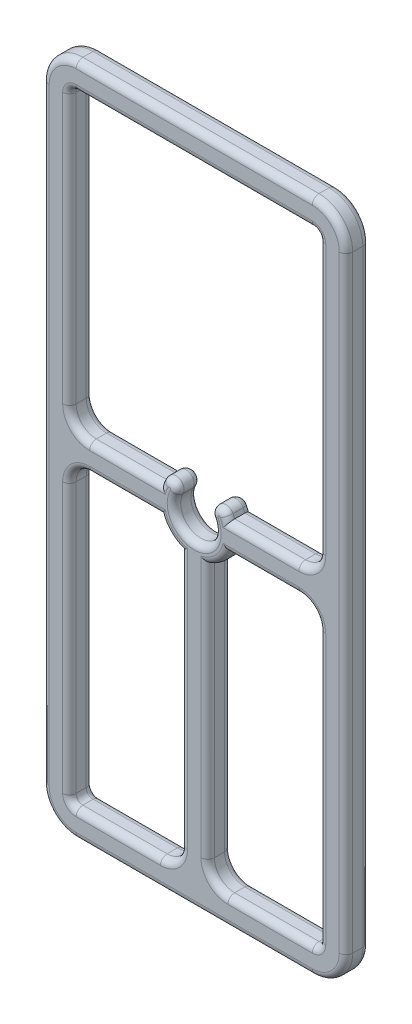
from build123d import *

# Parameters (mm, degrees)
SKETCH1_W           = 45
SKETCH1_H           = 100
BOSS_EXTRUDE2_DEPTH = 3.5
FILLET2_R           = 5
FILLET3_R           = 1
FILLET4_R           = 3
FILLET5_R           = 1


with BuildPart() as part:
    # Sketch1 → Boss-Extrude2 (new body)
    with BuildSketch(Plane.XY):
        Rectangle(SKETCH1_W, SKETCH1_H)
        with BuildLine():
            Line((-18.5, -46), (-18.5, -2))
            Line((-18.5, -2), (-5.015974482, -2))
            ThreePointArc((-5.015974482, -2), (-3.818376618, -3.818376618), (-2, -5.015974482))
            Line((-2, -5.015974482), (-2, -46))
            Line((-2, -46), (-18.5, -46))
        make_face(mode=Mode.SUBTRACT)
        with BuildLine():
            Line((18.5, 46), (-18.5, 46))
            Line((-18.5, 46), (-18.5, 2))
            Line((-18.5, 2), (-5.015974482, 2))
            ThreePointArc((-5.015974482, 2), (-4.894440416, 2.281327029), (-4.757142857, 2.555306603))
            ThreePointArc((-4.757142857, 2.555306603), (-3.132154088, 3.044603549), (-2.642857143, 1.41961478))
            ThreePointArc((-2.642857143, 1.41961478), (0, -3), (2.642857143, 1.41961478))
            ThreePointArc((2.642857143, 1.41961478), (3.132154088, 3.044603549), (4.757142857, 2.555306603))
            ThreePointArc((4.757142857, 2.555306603), (4.894440416, 2.281327029), (5.015974482, 2))
            Line((5.015974482, 2), (18.5, 2))
            Line((18.5, 2), (18.5, 46))
        make_face(mode=Mode.SUBTRACT)
        with BuildLine():
            Line((18.5, -46), (18.5, -2))
            Line((18.5, -2), (5.015974482, -2))
            ThreePointArc((5.015974482, -2), (3.818376618, -3.818376618), (2, -5.015974482))
            Line((2, -5.015974482), (2, -46))
            Line((2, -46), (18.5, -46))
        make_face(mode=Mode.SUBTRACT)
    extrude(amount=BOSS_EXTRUDE2_DEPTH)

    # Fillet2
    fillet2_edges = [part.edges().sort_by_distance(p)[0] for p in [
        (-22.5, 50, 1.75),
        (22.5, 50, 1.75),
        (22.5, -50, 1.75),
        (-22.5, -50, 1.75),
    ]]
    fillet(fillet2_edges, radius=FILLET2_R)

    # Fillet3
    fillet3_edges = [part.edges().sort_by_distance(p)[0] for p in [
        (18.5, 46, 1.75),
        (-18.5, 46, 1.75),
        (-18.5, -46, 1.75),
        (18.5, -46, 1.75),
    ]]
    fillet(fillet3_edges, radius=FILLET3_R)

    # Fillet4
    fillet4_edges = [part.edges().sort_by_distance(p)[0] for p in [
        (18.5, 2, 1.75),
        (-18.5, 2, 1.75),
        (-2, -46, 1.75),
        (-18.5, -2, 1.75),
        (2, -46, 1.75),
        (18.5, -2, 1.75),
    ]]
    fillet(fillet4_edges, radius=FILLET4_R)

    # Fillet5
    # the kernel refuses this fillet: 1 mm, written as the material it takes off along each edge
    with BuildSketch(Plane(origin=(17.5, 46, 0), x_dir=(0, 1, 0), z_dir=(-1, 0, 0)), Plane(origin=(17.5, 46, 3.5), x_dir=(0, 0, -1), z_dir=(-1, 0, 0)), Plane(origin=(17.5, -50, 0), x_dir=(0, 1, 0), z_dir=(-1, 0, 0)), Plane(origin=(17.5, -50, 3.5), x_dir=(0, 0, -1), z_dir=(-1, 0, 0)), Plane(origin=(-17.5, 50, 0), x_dir=(0, -1, 0), z_dir=(1, 0, 0)), Plane(origin=(-17.5, 50, 3.5), x_dir=(0, 0, -1), z_dir=(1, 0, 0))) as fillet5_piece_1:
        with BuildLine():
            CenterArc((FILLET5_R, -FILLET5_R), FILLET5_R, 90, 90)
            Line((0, -FILLET5_R), (0, 0))
            Line((0, 0), (FILLET5_R, 0))
        make_face()
    fillet5_piece_1_solid = extrude(amount=35, mode=Mode.PRIVATE)
    with BuildSketch(Plane(origin=(18.5, -45, 0), x_dir=(1, 0, 0), z_dir=(0, 1, 0)), Plane(origin=(18.5, -45, 3.5), x_dir=(0, 0, -1), z_dir=(0, 1, 0)), Plane(origin=(-18.5, 45, 0), x_dir=(-1, 0, 0), z_dir=(0, -1, 0)), Plane(origin=(-18.5, 45, 3.5), x_dir=(0, 0, -1), z_dir=(0, -1, 0)), Plane(origin=(18.5, 5, 3.5), x_dir=(0, 0, -1), z_dir=(0, 1, 0)), Plane(origin=(18.5, 5, 0), x_dir=(1, 0, 0), z_dir=(0, 1, 0))) as fillet5_piece_2:
        with BuildLine():
            CenterArc((FILLET5_R, -FILLET5_R), FILLET5_R, 90, 90)
            Line((0, -FILLET5_R), (0, 0))
            Line((0, 0), (FILLET5_R, 0))
        make_face()
    fillet5_piece_2_solid = extrude(amount=40, mode=Mode.PRIVATE)
    with BuildSketch(Plane(origin=(-5, -46, 0), x_dir=(0, -1, 0), z_dir=(-1, 0, 0)), Plane(origin=(-5, -46, 3.5), x_dir=(0, 0, -1), z_dir=(-1, 0, 0))) as fillet5_piece_3:
        with BuildLine():
            CenterArc((FILLET5_R, FILLET5_R), FILLET5_R, 180, 90)
            Line((0, FILLET5_R), (0, 0))
            Line((0, 0), (FILLET5_R, 0))
        make_face()
    fillet5_piece_3_solid = extrude(amount=12.5, mode=Mode.PRIVATE)
    with BuildSketch(Plane(origin=(17.5, 45, 0), x_dir=(0, 1, 0), z_dir=(-1, 0, 0))) as fillet5_piece_4:
        with BuildLine():
            CenterArc((1 + FILLET5_R, -FILLET5_R), FILLET5_R, 90, 90)
            Line((1, -FILLET5_R), (1, 0))
            Line((1, 0), (1 + FILLET5_R, 0))
        make_face()
    fillet5_piece_4_solid = revolve(axis=Axis((17.5, 45, 0), (0, 0, -1)), revolution_arc=90, mode=Mode.PRIVATE)
    with BuildSketch(Plane(origin=(17.5, 45, 3.5), x_dir=(0, 1, 0), z_dir=(-1, 0, 0))) as fillet5_piece_5:
        with BuildLine():
            CenterArc((1 + FILLET5_R, FILLET5_R), FILLET5_R, 180, 90)
            Line((1 + FILLET5_R, 0), (1, 0))
            Line((1, 0), (1, FILLET5_R))
        make_face()
    fillet5_piece_5_solid = revolve(axis=Axis((17.5, 45, 3.5), (0, 0, -1)), revolution_arc=90, mode=Mode.PRIVATE)
    with BuildSketch(Plane(origin=(17.5, -45, 0), x_dir=(1, 0, 0), z_dir=(0, 1, 0))) as fillet5_piece_6:
        with BuildLine():
            CenterArc((1 + FILLET5_R, -FILLET5_R), FILLET5_R, 90, 90)
            Line((1, -FILLET5_R), (1, 0))
            Line((1, 0), (1 + FILLET5_R, 0))
        make_face()
    fillet5_piece_6_solid = revolve(axis=Axis((17.5, -45, 0), (0, 0, -1)), revolution_arc=90, mode=Mode.PRIVATE)
    with BuildSketch(Plane(origin=(17.5, -45, 3.5), x_dir=(1, 0, 0), z_dir=(0, 1, 0))) as fillet5_piece_7:
        with BuildLine():
            CenterArc((1 + FILLET5_R, FILLET5_R), FILLET5_R, 180, 90)
            Line((1 + FILLET5_R, 0), (1, 0))
            Line((1, 0), (1, FILLET5_R))
        make_face()
    fillet5_piece_7_solid = revolve(axis=Axis((17.5, -45, 3.5), (0, 0, -1)), revolution_arc=90, mode=Mode.PRIVATE)
    with BuildSketch(Plane(origin=(-17.5, -45, 0), x_dir=(-1, 0, 0), z_dir=(0, 1, 0))) as fillet5_piece_8:
        with BuildLine():
            CenterArc((1 + FILLET5_R, FILLET5_R), FILLET5_R, 180, 90)
            Line((1, FILLET5_R), (1, 0))
            Line((1, 0), (1 + FILLET5_R, 0))
        make_face()
    fillet5_piece_8_solid = revolve(axis=Axis((-17.5, -45, 0), (0, 0, 1)), revolution_arc=90, mode=Mode.PRIVATE)
    with BuildSketch(Plane(origin=(-17.5, -45, 3.5), x_dir=(-1, 0, 0), z_dir=(0, 1, 0))) as fillet5_piece_9:
        with BuildLine():
            CenterArc((1 + FILLET5_R, -FILLET5_R), FILLET5_R, 90, 90)
            Line((1 + FILLET5_R, 0), (1, 0))
            Line((1, 0), (1, -FILLET5_R))
        make_face()
    fillet5_piece_9_solid = revolve(axis=Axis((-17.5, -45, 3.5), (0, 0, 1)), revolution_arc=90, mode=Mode.PRIVATE)
    with BuildSketch(Plane(origin=(-17.5, 45, 0), x_dir=(0, 1, 0), z_dir=(1, 0, 0))) as fillet5_piece_10:
        with BuildLine():
            CenterArc((1 + FILLET5_R, FILLET5_R), FILLET5_R, 180, 90)
            Line((1, FILLET5_R), (1, 0))
            Line((1, 0), (1 + FILLET5_R, 0))
        make_face()
    fillet5_piece_10_solid = revolve(axis=Axis((-17.5, 45, 0), (0, 0, 1)), revolution_arc=90, mode=Mode.PRIVATE)
    with BuildSketch(Plane(origin=(-17.5, 45, 3.5), x_dir=(0, 1, 0), z_dir=(1, 0, 0))) as fillet5_piece_11:
        with BuildLine():
            CenterArc((1 + FILLET5_R, -FILLET5_R), FILLET5_R, 90, 90)
            Line((1 + FILLET5_R, 0), (1, 0))
            Line((1, 0), (1, -FILLET5_R))
        make_face()
    fillet5_piece_11_solid = revolve(axis=Axis((-17.5, 45, 3.5), (0, 0, 1)), revolution_arc=90, mode=Mode.PRIVATE)
    with BuildSketch(Plane(origin=(-15.5, 2, 0), x_dir=(0, -1, 0), z_dir=(1, 0, 0))) as fillet5_piece_12_section:
        with BuildLine():
            CenterArc((FILLET5_R, -FILLET5_R), FILLET5_R, 90, 90)
            Line((0, -FILLET5_R), (0, 0))
            Line((0, 0), (FILLET5_R, 0))
        make_face()
    fillet5_piece_12 = extrude(amount=12.984025518, mode=Mode.PRIVATE)
    fillet5_piece_12 = fillet5_piece_12 - Plane(origin=(0, 0, 0.227276512), x_dir=(-0.9288841632581055, 0.3703703703703757, 0), z_dir=(0, 0, -1)) * Cylinder(5.4, 30, mode=Mode.PRIVATE)
    with BuildSketch(Plane(origin=(-15.5, 2, 3.5), x_dir=(0, 0, -1), z_dir=(1, 0, 0))) as fillet5_piece_13_section:
        with BuildLine():
            CenterArc((FILLET5_R, -FILLET5_R), FILLET5_R, 90, 90)
            Line((0, -FILLET5_R), (0, 0))
            Line((0, 0), (FILLET5_R, 0))
        make_face()
    fillet5_piece_13 = extrude(amount=12.984025518, mode=Mode.PRIVATE)
    fillet5_piece_13 = fillet5_piece_13 - Plane(origin=(0, 0, 3.272723448), x_dir=(-0.9288841632581055, 0.3703703703703757, 0), z_dir=(0, 0, -1)) * Cylinder(5.4, 30, mode=Mode.PRIVATE)
    with BuildSketch(Plane(origin=(-18.5, -45, 3.5), x_dir=(0, 0, -1), z_dir=(0, 1, 0)), Plane(origin=(-18.5, -45, 0), x_dir=(-1, 0, 0), z_dir=(0, 1, 0))) as fillet5_piece_14:
        with BuildLine():
            CenterArc((FILLET5_R, FILLET5_R), FILLET5_R, 180, 90)
            Line((0, FILLET5_R), (0, 0))
            Line((0, 0), (FILLET5_R, 0))
        make_face()
    fillet5_piece_14_solid = extrude(amount=40, mode=Mode.PRIVATE)
    with BuildSketch(Plane(origin=(15.5, -2, 0), x_dir=(0, 1, 0), z_dir=(-1, 0, 0))) as fillet5_piece_15_section:
        with BuildLine():
            CenterArc((FILLET5_R, -FILLET5_R), FILLET5_R, 90, 90)
            Line((0, -FILLET5_R), (0, 0))
            Line((0, 0), (FILLET5_R, 0))
        make_face()
    fillet5_piece_15 = extrude(amount=12.984025518, mode=Mode.PRIVATE)
    fillet5_piece_15 = fillet5_piece_15 - Plane(origin=(0, 0, 0.227276512), x_dir=(0.9288841632581075, -0.37037037037037057, 0), z_dir=(0, 0, -1)) * Cylinder(5.4, 30, mode=Mode.PRIVATE)
    with BuildSketch(Plane(origin=(15.5, -2, 3.5), x_dir=(0, 0, -1), z_dir=(-1, 0, 0))) as fillet5_piece_16_section:
        with BuildLine():
            CenterArc((FILLET5_R, -FILLET5_R), FILLET5_R, 90, 90)
            Line((0, -FILLET5_R), (0, 0))
            Line((0, 0), (FILLET5_R, 0))
        make_face()
    fillet5_piece_16 = extrude(amount=12.984025518, mode=Mode.PRIVATE)
    fillet5_piece_16 = fillet5_piece_16 - Plane(origin=(0, 0, 3.272723442), x_dir=(0.9288841632581075, -0.37037037037037057, 0), z_dir=(0, 0, -1)) * Cylinder(5.4, 30, mode=Mode.PRIVATE)
    with BuildSketch(Plane(origin=(5, -46, 3.5), x_dir=(0, 0, -1), z_dir=(1, 0, 0)), Plane(origin=(5, -46, 0), x_dir=(0, -1, 0), z_dir=(1, 0, 0))) as fillet5_piece_17:
        with BuildLine():
            CenterArc((FILLET5_R, -FILLET5_R), FILLET5_R, 90, 90)
            Line((0, -FILLET5_R), (0, 0))
            Line((0, 0), (FILLET5_R, 0))
        make_face()
    fillet5_piece_17_solid = extrude(amount=12.5, mode=Mode.PRIVATE)
    with BuildSketch(Plane(origin=(-2, -2.515974482, 0), x_dir=(1, 0, 0), z_dir=(0, -1, 0))) as fillet5_piece_18_section:
        with BuildLine():
            CenterArc((FILLET5_R, FILLET5_R), FILLET5_R, 180, 90)
            Line((0, FILLET5_R), (0, 0))
            Line((0, 0), (FILLET5_R, 0))
        make_face()
    fillet5_piece_18 = extrude(amount=40.484025518, mode=Mode.PRIVATE)
    fillet5_piece_18 = fillet5_piece_18 - Plane(origin=(0, 0, 0.226636486), x_dir=(-0.9288841632581076, -0.3703703703703703, 0), z_dir=(0, 0, -1)) * Cylinder(5.4, 85, mode=Mode.PRIVATE)
    with BuildSketch(Plane(origin=(-2, -2.515974482, 3.5), x_dir=(0, 0, -1), z_dir=(0, -1, 0))) as fillet5_piece_19_section:
        with BuildLine():
            CenterArc((FILLET5_R, FILLET5_R), FILLET5_R, 180, 90)
            Line((0, FILLET5_R), (0, 0))
            Line((0, 0), (FILLET5_R, 0))
        make_face()
    fillet5_piece_19 = extrude(amount=40.484025518, mode=Mode.PRIVATE)
    fillet5_piece_19 = fillet5_piece_19 - Plane(origin=(0, 0, 3.273363506), x_dir=(-0.9288841632581076, -0.3703703703703703, 0), z_dir=(0, 0, -1)) * Cylinder(5.4, 85, mode=Mode.PRIVATE)
    with BuildSketch(Plane(origin=(15.5, 5, 0), x_dir=(1, 0, 0), z_dir=(0, 1, 0))) as fillet5_piece_20:
        with BuildLine():
            CenterArc((3 + FILLET5_R, -FILLET5_R), FILLET5_R, 90, 90)
            Line((3, -FILLET5_R), (3, 0))
            Line((3, 0), (3 + FILLET5_R, 0))
        make_face()
    fillet5_piece_20_solid = revolve(axis=Axis((15.5, 5, 0), (0, 0, -1)), revolution_arc=90, mode=Mode.PRIVATE)
    with BuildSketch(Plane(origin=(15.5, 5, 3.5), x_dir=(1, 0, 0), z_dir=(0, 1, 0))) as fillet5_piece_21:
        with BuildLine():
            CenterArc((3 + FILLET5_R, FILLET5_R), FILLET5_R, 180, 90)
            Line((3 + FILLET5_R, 0), (3, 0))
            Line((3, 0), (3, FILLET5_R))
        make_face()
    fillet5_piece_21_solid = revolve(axis=Axis((15.5, 5, 3.5), (0, 0, -1)), revolution_arc=90, mode=Mode.PRIVATE)
    with BuildSketch(Plane(origin=(-15.5, 5, 0), x_dir=(-1, 0, 0), z_dir=(0, 1, 0))) as fillet5_piece_22:
        with BuildLine():
            CenterArc((3 + FILLET5_R, FILLET5_R), FILLET5_R, 180, 90)
            Line((3, FILLET5_R), (3, 0))
            Line((3, 0), (3 + FILLET5_R, 0))
        make_face()
    fillet5_piece_22_solid = revolve(axis=Axis((-15.5, 5, 0), (0, 0, 1)), revolution_arc=90, mode=Mode.PRIVATE)
    with BuildSketch(Plane(origin=(-15.5, 5, 3.5), x_dir=(-1, 0, 0), z_dir=(0, 1, 0))) as fillet5_piece_23:
        with BuildLine():
            CenterArc((3 + FILLET5_R, -FILLET5_R), FILLET5_R, 90, 90)
            Line((3 + FILLET5_R, 0), (3, 0))
            Line((3, 0), (3, -FILLET5_R))
        make_face()
    fillet5_piece_23_solid = revolve(axis=Axis((-15.5, 5, 3.5), (0, 0, 1)), revolution_arc=90, mode=Mode.PRIVATE)
    with BuildSketch(Plane(origin=(-15.5, -5, 0), x_dir=(-1, 0, 0), z_dir=(0, -1, 0))) as fillet5_piece_24:
        with BuildLine():
            CenterArc((3 + FILLET5_R, -FILLET5_R), FILLET5_R, 90, 90)
            Line((3, -FILLET5_R), (3, 0))
            Line((3, 0), (3 + FILLET5_R, 0))
        make_face()
    fillet5_piece_24_solid = revolve(axis=Axis((-15.5, -5, 0), (0, 0, -1)), revolution_arc=90, mode=Mode.PRIVATE)
    with BuildSketch(Plane(origin=(-15.5, -5, 3.5), x_dir=(-1, 0, 0), z_dir=(0, -1, 0))) as fillet5_piece_25:
        with BuildLine():
            CenterArc((3 + FILLET5_R, FILLET5_R), FILLET5_R, 180, 90)
            Line((3 + FILLET5_R, 0), (3, 0))
            Line((3, 0), (3, FILLET5_R))
        make_face()
    fillet5_piece_25_solid = revolve(axis=Axis((-15.5, -5, 3.5), (0, 0, -1)), revolution_arc=90, mode=Mode.PRIVATE)
    with BuildSketch(Plane(origin=(15.5, -5, 0), x_dir=(1, 0, 0), z_dir=(0, -1, 0))) as fillet5_piece_26:
        with BuildLine():
            CenterArc((3 + FILLET5_R, FILLET5_R), FILLET5_R, 180, 90)
            Line((3, FILLET5_R), (3, 0))
            Line((3, 0), (3 + FILLET5_R, 0))
        make_face()
    fillet5_piece_26_solid = revolve(axis=Axis((15.5, -5, 0), (0, 0, 1)), revolution_arc=90, mode=Mode.PRIVATE)
    with BuildSketch(Plane(origin=(15.5, -5, 3.5), x_dir=(1, 0, 0), z_dir=(0, -1, 0))) as fillet5_piece_27:
        with BuildLine():
            CenterArc((3 + FILLET5_R, -FILLET5_R), FILLET5_R, 90, 90)
            Line((3 + FILLET5_R, 0), (3, 0))
            Line((3, 0), (3, -FILLET5_R))
        make_face()
    fillet5_piece_27_solid = revolve(axis=Axis((15.5, -5, 3.5), (0, 0, 1)), revolution_arc=90, mode=Mode.PRIVATE)
    with BuildSketch(Plane(origin=(5, -43, 0), x_dir=(0, -1, 0), z_dir=(1, 0, 0))) as fillet5_piece_28:
        with BuildLine():
            CenterArc((3 + FILLET5_R, -FILLET5_R), FILLET5_R, 90, 90)
            Line((3, -FILLET5_R), (3, 0))
            Line((3, 0), (3 + FILLET5_R, 0))
        make_face()
    fillet5_piece_28_solid = revolve(axis=Axis((5, -43, 0), (0, 0, -1)), revolution_arc=90, mode=Mode.PRIVATE)
    with BuildSketch(Plane(origin=(5, -43, 3.5), x_dir=(0, -1, 0), z_dir=(1, 0, 0))) as fillet5_piece_29:
        with BuildLine():
            CenterArc((3 + FILLET5_R, FILLET5_R), FILLET5_R, 180, 90)
            Line((3 + FILLET5_R, 0), (3, 0))
            Line((3, 0), (3, FILLET5_R))
        make_face()
    fillet5_piece_29_solid = revolve(axis=Axis((5, -43, 3.5), (0, 0, -1)), revolution_arc=90, mode=Mode.PRIVATE)
    with BuildSketch(Plane(origin=(-5, -43, 0), x_dir=(0, -1, 0), z_dir=(-1, 0, 0))) as fillet5_piece_30:
        with BuildLine():
            CenterArc((3 + FILLET5_R, FILLET5_R), FILLET5_R, 180, 90)
            Line((3, FILLET5_R), (3, 0))
            Line((3, 0), (3 + FILLET5_R, 0))
        make_face()
    fillet5_piece_30_solid = revolve(axis=Axis((-5, -43, 0), (0, 0, 1)), revolution_arc=90, mode=Mode.PRIVATE)
    with BuildSketch(Plane(origin=(-5, -43, 3.5), x_dir=(0, -1, 0), z_dir=(-1, 0, 0))) as fillet5_piece_31:
        with BuildLine():
            CenterArc((3 + FILLET5_R, -FILLET5_R), FILLET5_R, 90, 90)
            Line((3 + FILLET5_R, 0), (3, 0))
            Line((3, 0), (3, -FILLET5_R))
        make_face()
    fillet5_piece_31_solid = revolve(axis=Axis((-5, -43, 3.5), (0, 0, 1)), revolution_arc=90, mode=Mode.PRIVATE)
    with BuildSketch(Plane(origin=(0, 0, 0), x_dir=(-0.9965112096456376, -0.08345902617804783, 0), z_dir=(0.08345902617804783, -0.9965112096456376, 0))) as fillet5_piece_32_section:
        with BuildLine():
            CenterArc((5.4 - FILLET5_R, -FILLET5_R), FILLET5_R, 0, 90)
            Line((5.4, -FILLET5_R), (5.4, 0))
            Line((5.4, 0), (5.4 - FILLET5_R, 0))
        make_face()
    fillet5_piece_32 = revolve(axis=Axis((0, 0, 0), (0, 0, -1)), revolution_arc=33.029955876, mode=Mode.PRIVATE)
    fillet5_piece_32 = split(fillet5_piece_32, bisect_by=Plane(origin=(-4.715825889, 2, 0.254964031), z_dir=(0, 1, 0)), keep=Keep.TOP, mode=Mode.PRIVATE)
    with BuildSketch(Plane(origin=(-3.7, 1.987460691, 0), x_dir=(-0.8809523809523815, 0.4732049265321848, 0), z_dir=(-0.4732049265321848, -0.8809523809523815, 0))) as fillet5_piece_33:
        with BuildLine():
            CenterArc((1.2 - FILLET5_R, -FILLET5_R), FILLET5_R, 0, 90)
            Line((1.2, -FILLET5_R), (1.2, 0))
            Line((1.2, 0), (1.2 - FILLET5_R, 0))
        make_face()
    fillet5_piece_33_solid = revolve(axis=Axis((-3.7, 1.987460691, 0), (0, 0, -1)), revolution_arc=180, mode=Mode.PRIVATE)
    with BuildSketch(Plane(origin=(0, 0, 0), x_dir=(-0.880952380952381, 0.4732049265321854, 0), z_dir=(0.4732049265321854, 0.880952380952381, 0))) as fillet5_piece_34:
        with BuildLine():
            CenterArc((3 + FILLET5_R, FILLET5_R), FILLET5_R, 180, 90)
            Line((3, FILLET5_R), (3, 0))
            Line((3, 0), (3 + FILLET5_R, 0))
        make_face()
    fillet5_piece_34_solid = revolve(axis=Axis((0, 0, 0), (0, 0, 1)), revolution_arc=236.485074369, mode=Mode.PRIVATE)
    with BuildSketch(Plane(origin=(3.7, 1.987460691, 0), x_dir=(-0.8809523809523807, -0.47320492653218593, 0), z_dir=(0.47320492653218593, -0.8809523809523807, 0))) as fillet5_piece_35:
        with BuildLine():
            CenterArc((1.2 - FILLET5_R, -FILLET5_R), FILLET5_R, 0, 90)
            Line((1.2, -FILLET5_R), (1.2, 0))
            Line((1.2, 0), (1.2 - FILLET5_R, 0))
        make_face()
    fillet5_piece_35_solid = revolve(axis=Axis((3.7, 1.987460691, 0), (0, 0, -1)), revolution_arc=180, mode=Mode.PRIVATE)
    with BuildSketch(Plane(origin=(0, 0, 0), x_dir=(0.8809523809523792, 0.47320492653218904, 0), z_dir=(-0.47320492653218904, 0.8809523809523792, 0))) as fillet5_piece_36_section:
        with BuildLine():
            CenterArc((5.4 - FILLET5_R, -FILLET5_R), FILLET5_R, 0, 90)
            Line((5.4, -FILLET5_R), (5.4, 0))
            Line((5.4, 0), (5.4 - FILLET5_R, 0))
        make_face()
    fillet5_piece_36 = revolve(axis=Axis((0, 0, 0), (0, 0, -1)), revolution_arc=33.029955876, mode=Mode.PRIVATE)
    fillet5_piece_36 = split(fillet5_piece_36, bisect_by=Plane(origin=(4.715825844, 2, 0.254964127), z_dir=(0, 1, 0)), keep=Keep.TOP, mode=Mode.PRIVATE)
    with BuildSketch(Plane(origin=(2.515974482, 2, 0), x_dir=(0, -1, 0), z_dir=(1, 0, 0))) as fillet5_piece_37_section:
        with BuildLine():
            CenterArc((FILLET5_R, -FILLET5_R), FILLET5_R, 90, 90)
            Line((0, -FILLET5_R), (0, 0))
            Line((0, 0), (FILLET5_R, 0))
        make_face()
    fillet5_piece_37 = extrude(amount=12.984025518, mode=Mode.PRIVATE)
    fillet5_piece_37 = fillet5_piece_37 - Plane(origin=(0, 0, 0.227275372), x_dir=(0.8809523809523792, 0.47320492653218904, 0), z_dir=(0, 0, -1)) * Cylinder(5.4, 30, mode=Mode.PRIVATE)
    with BuildSketch(Plane(origin=(0, 0, 3.5), x_dir=(-0.9965112096456376, -0.08345902617804792, 0), z_dir=(0.08345902617804792, -0.9965112096456376, 0))) as fillet5_piece_38_section:
        with BuildLine():
            CenterArc((5.4 - FILLET5_R, FILLET5_R), FILLET5_R, 270, 90)
            Line((5.4 - FILLET5_R, 0), (5.4, 0))
            Line((5.4, 0), (5.4, FILLET5_R))
        make_face()
    fillet5_piece_38 = revolve(axis=Axis((0, 0, 3.5), (0, 0, -1)), revolution_arc=33.029955876, mode=Mode.PRIVATE)
    fillet5_piece_38 = split(fillet5_piece_38, bisect_by=Plane(origin=(-4.715825889, 2, 3.24503597), z_dir=(0, 1, 0)), keep=Keep.TOP, mode=Mode.PRIVATE)
    with BuildSketch(Plane(origin=(-3.7, 1.987460691, 3.5), x_dir=(-0.8809523809523815, 0.4732049265321848, 0), z_dir=(-0.4732049265321848, -0.8809523809523815, 0))) as fillet5_piece_39:
        with BuildLine():
            CenterArc((1.2 - FILLET5_R, FILLET5_R), FILLET5_R, 270, 90)
            Line((1.2 - FILLET5_R, 0), (1.2, 0))
            Line((1.2, 0), (1.2, FILLET5_R))
        make_face()
    fillet5_piece_39_solid = revolve(axis=Axis((-3.7, 1.987460691, 3.5), (0, 0, -1)), revolution_arc=180, mode=Mode.PRIVATE)
    with BuildSketch(Plane(origin=(0, 0, 3.5), x_dir=(-0.880952380952381, 0.4732049265321854, 0), z_dir=(0.4732049265321854, 0.880952380952381, 0))) as fillet5_piece_40:
        with BuildLine():
            CenterArc((3 + FILLET5_R, -FILLET5_R), FILLET5_R, 90, 90)
            Line((3 + FILLET5_R, 0), (3, 0))
            Line((3, 0), (3, -FILLET5_R))
        make_face()
    fillet5_piece_40_solid = revolve(axis=Axis((0, 0, 3.5), (0, 0, 1)), revolution_arc=236.485074369, mode=Mode.PRIVATE)
    with BuildSketch(Plane(origin=(3.7, 1.987460691, 3.5), x_dir=(-0.8809523809523807, -0.47320492653218593, 0), z_dir=(0.47320492653218593, -0.8809523809523807, 0))) as fillet5_piece_41:
        with BuildLine():
            CenterArc((1.2 - FILLET5_R, FILLET5_R), FILLET5_R, 270, 90)
            Line((1.2 - FILLET5_R, 0), (1.2, 0))
            Line((1.2, 0), (1.2, FILLET5_R))
        make_face()
    fillet5_piece_41_solid = revolve(axis=Axis((3.7, 1.987460691, 3.5), (0, 0, -1)), revolution_arc=180, mode=Mode.PRIVATE)
    with BuildSketch(Plane(origin=(0, 0, 3.5), x_dir=(0.8809523809523792, 0.47320492653218904, 0), z_dir=(-0.47320492653218904, 0.8809523809523792, 0))) as fillet5_piece_42_section:
        with BuildLine():
            CenterArc((5.4 - FILLET5_R, FILLET5_R), FILLET5_R, 270, 90)
            Line((5.4 - FILLET5_R, 0), (5.4, 0))
            Line((5.4, 0), (5.4, FILLET5_R))
        make_face()
    fillet5_piece_42 = revolve(axis=Axis((0, 0, 3.5), (0, 0, -1)), revolution_arc=33.029955876, mode=Mode.PRIVATE)
    fillet5_piece_42 = split(fillet5_piece_42, bisect_by=Plane(origin=(4.715825836, 2, 3.245035869), z_dir=(0, 1, 0)), keep=Keep.TOP, mode=Mode.PRIVATE)
    with BuildSketch(Plane(origin=(2.515974482, 2, 3.5), x_dir=(0, 0, -1), z_dir=(1, 0, 0))) as fillet5_piece_43_section:
        with BuildLine():
            CenterArc((FILLET5_R, -FILLET5_R), FILLET5_R, 90, 90)
            Line((0, -FILLET5_R), (0, 0))
            Line((0, 0), (FILLET5_R, 0))
        make_face()
    fillet5_piece_43 = extrude(amount=12.984025518, mode=Mode.PRIVATE)
    fillet5_piece_43 = fillet5_piece_43 - Plane(origin=(0, 0, 3.272724589), x_dir=(0.8809523809523792, 0.47320492653218904, 0), z_dir=(0, 0, -1)) * Cylinder(5.4, 30, mode=Mode.PRIVATE)
    with BuildSketch(Plane(origin=(0, 0, 0), x_dir=(-0.9965071428980741, 0.08350756943605434, 0), z_dir=(0.08350756943605434, 0.9965071428980741, 0))) as fillet5_piece_44_section:
        with BuildLine():
            CenterArc((5.4 - FILLET5_R, FILLET5_R), FILLET5_R, 270, 90)
            Line((5.4, FILLET5_R), (5.4, 0))
            Line((5.4, 0), (5.4 - FILLET5_R, 0))
        make_face()
    fillet5_piece_44 = revolve(axis=Axis((0, 0, 0), (0, 0, 1)), revolution_arc=99.580419517, mode=Mode.PRIVATE)
    fillet5_piece_44 = split(fillet5_piece_44, bisect_by=Plane(origin=(-3.579031404, -2, 0.237447939), z_dir=(0, -1, 0)), keep=Keep.TOP, mode=Mode.PRIVATE)
    fillet5_piece_44 = split(fillet5_piece_44, bisect_by=Plane(origin=(-2, -3.579031269, 0.237447939), z_dir=(-1, 0, 0)), keep=Keep.TOP, mode=Mode.PRIVATE)
    with BuildSketch(Plane(origin=(-15.5, -2, 0), x_dir=(0, 1, 0), z_dir=(1, 0, 0))) as fillet5_piece_45_section:
        with BuildLine():
            CenterArc((FILLET5_R, FILLET5_R), FILLET5_R, 180, 90)
            Line((0, FILLET5_R), (0, 0))
            Line((0, 0), (FILLET5_R, 0))
        make_face()
    fillet5_piece_45 = extrude(amount=12.984025518, mode=Mode.PRIVATE)
    fillet5_piece_45 = fillet5_piece_45 - Plane(origin=(0, 0, 0.227276512), x_dir=(-0.9288841632581076, -0.3703703703703703, 0), z_dir=(0, 0, -1)) * Cylinder(5.4, 30, mode=Mode.PRIVATE)
    with BuildSketch(Plane(origin=(0, 0, 3.5), x_dir=(-0.9965071428980741, 0.08350756943605434, 0), z_dir=(0.08350756943605434, 0.9965071428980741, 0))) as fillet5_piece_46_section:
        with BuildLine():
            CenterArc((5.4 - FILLET5_R, -FILLET5_R), FILLET5_R, 0, 90)
            Line((5.4 - FILLET5_R, 0), (5.4, 0))
            Line((5.4, 0), (5.4, -FILLET5_R))
        make_face()
    fillet5_piece_46 = revolve(axis=Axis((0, 0, 3.5), (0, 0, 1)), revolution_arc=99.580419517, mode=Mode.PRIVATE)
    fillet5_piece_46 = split(fillet5_piece_46, bisect_by=Plane(origin=(-3.579031373, -2, 3.262552053), z_dir=(0, -1, 0)), keep=Keep.TOP, mode=Mode.PRIVATE)
    fillet5_piece_46 = split(fillet5_piece_46, bisect_by=Plane(origin=(-2, -3.579031281, 3.262552053), z_dir=(-1, 0, 0)), keep=Keep.TOP, mode=Mode.PRIVATE)
    with BuildSketch(Plane(origin=(-15.5, -2, 3.5), x_dir=(0, 0, -1), z_dir=(1, 0, 0))) as fillet5_piece_47_section:
        with BuildLine():
            CenterArc((FILLET5_R, FILLET5_R), FILLET5_R, 180, 90)
            Line((0, FILLET5_R), (0, 0))
            Line((0, 0), (FILLET5_R, 0))
        make_face()
    fillet5_piece_47 = extrude(amount=12.984025518, mode=Mode.PRIVATE)
    fillet5_piece_47 = fillet5_piece_47 - Plane(origin=(0, 0, 3.272723442), x_dir=(-0.9288841632581076, -0.3703703703703703, 0), z_dir=(0, 0, -1)) * Cylinder(5.4, 30, mode=Mode.PRIVATE)
    with BuildSketch(Plane(origin=(0, 0, 0), x_dir=(0.9965071428980741, 0.08350756943605364, 0), z_dir=(-0.08350756943605364, 0.9965071428980741, 0))) as fillet5_piece_48_section:
        with BuildLine():
            CenterArc((5.4 - FILLET5_R, -FILLET5_R), FILLET5_R, 0, 90)
            Line((5.4, -FILLET5_R), (5.4, 0))
            Line((5.4, 0), (5.4 - FILLET5_R, 0))
        make_face()
    fillet5_piece_48 = revolve(axis=Axis((0, 0, 0), (0, 0, -1)), revolution_arc=99.580419517, mode=Mode.PRIVATE)
    fillet5_piece_48 = split(fillet5_piece_48, bisect_by=Plane(origin=(3.579031404, -2, 0.237447939), z_dir=(0, -1, 0)), keep=Keep.TOP, mode=Mode.PRIVATE)
    fillet5_piece_48 = split(fillet5_piece_48, bisect_by=Plane(origin=(2, -3.579031269, 0.237447939), z_dir=(1, 0, 0)), keep=Keep.TOP, mode=Mode.PRIVATE)
    with BuildSketch(Plane(origin=(2, -2.515974482, 0), x_dir=(-1, 0, 0), z_dir=(0, -1, 0))) as fillet5_piece_49_section:
        with BuildLine():
            CenterArc((FILLET5_R, -FILLET5_R), FILLET5_R, 90, 90)
            Line((0, -FILLET5_R), (0, 0))
            Line((0, 0), (FILLET5_R, 0))
        make_face()
    fillet5_piece_49 = extrude(amount=40.484025518, mode=Mode.PRIVATE)
    fillet5_piece_49 = fillet5_piece_49 - Plane(origin=(0, 0, 0.226636486), x_dir=(0.9288841632581075, -0.37037037037037057, 0), z_dir=(0, 0, -1)) * Cylinder(5.4, 85, mode=Mode.PRIVATE)
    with BuildSketch(Plane(origin=(0, 0, 3.5), x_dir=(0.9965071428980741, 0.08350756943605378, 0), z_dir=(-0.08350756943605378, 0.9965071428980741, 0))) as fillet5_piece_50_section:
        with BuildLine():
            CenterArc((5.4 - FILLET5_R, FILLET5_R), FILLET5_R, 270, 90)
            Line((5.4 - FILLET5_R, 0), (5.4, 0))
            Line((5.4, 0), (5.4, FILLET5_R))
        make_face()
    fillet5_piece_50 = revolve(axis=Axis((0, 0, 3.5), (0, 0, -1)), revolution_arc=99.580419517, mode=Mode.PRIVATE)
    fillet5_piece_50 = split(fillet5_piece_50, bisect_by=Plane(origin=(3.579031373, -2, 3.262552053), z_dir=(0, -1, 0)), keep=Keep.TOP, mode=Mode.PRIVATE)
    fillet5_piece_50 = split(fillet5_piece_50, bisect_by=Plane(origin=(2, -3.579031281, 3.262552053), z_dir=(1, 0, 0)), keep=Keep.TOP, mode=Mode.PRIVATE)
    with BuildSketch(Plane(origin=(2, -2.515974482, 3.5), x_dir=(0, 0, -1), z_dir=(0, -1, 0))) as fillet5_piece_51_section:
        with BuildLine():
            CenterArc((FILLET5_R, -FILLET5_R), FILLET5_R, 90, 90)
            Line((0, -FILLET5_R), (0, 0))
            Line((0, 0), (FILLET5_R, 0))
        make_face()
    fillet5_piece_51 = extrude(amount=40.484025518, mode=Mode.PRIVATE)
    fillet5_piece_51 = fillet5_piece_51 - Plane(origin=(0, 0, 3.273363503), x_dir=(0.9288841632581075, -0.37037037037037057, 0), z_dir=(0, 0, -1)) * Cylinder(5.4, 85, mode=Mode.PRIVATE)
    with BuildSketch(Plane(origin=(-22.5, -45, 0), x_dir=(1, 0, 0), z_dir=(0, 1, 0)), Plane(origin=(22.5, 45, 0), x_dir=(-1, 0, 0), z_dir=(0, -1, 0)), Plane(origin=(-22.5, -45, 3.5), x_dir=(0, 0, -1), z_dir=(0, 1, 0)), Plane(origin=(22.5, 45, 3.5), x_dir=(0, 0, -1), z_dir=(0, -1, 0))) as fillet5_piece_52:
        with BuildLine():
            CenterArc((FILLET5_R, -FILLET5_R), FILLET5_R, 90, 90)
            Line((0, -FILLET5_R), (0, 0))
            Line((0, 0), (FILLET5_R, 0))
        make_face()
    fillet5_piece_52_solid = extrude(amount=90, mode=Mode.PRIVATE)
    with BuildSketch(Plane(origin=(-17.5, 45, 0), x_dir=(-1, 0, 0), z_dir=(0, -1, 0))) as fillet5_piece_53:
        with BuildLine():
            CenterArc((5 - FILLET5_R, -FILLET5_R), FILLET5_R, 0, 90)
            Line((5, -FILLET5_R), (5, 0))
            Line((5, 0), (5 - FILLET5_R, 0))
        make_face()
    fillet5_piece_53_solid = revolve(axis=Axis((-17.5, 45, 0), (0, 0, -1)), revolution_arc=90, mode=Mode.PRIVATE)
    with BuildSketch(Plane(origin=(17.5, 45, 0), x_dir=(0, 1, 0), z_dir=(-1, 0, 0))) as fillet5_piece_54:
        with BuildLine():
            CenterArc((5 - FILLET5_R, -FILLET5_R), FILLET5_R, 0, 90)
            Line((5, -FILLET5_R), (5, 0))
            Line((5, 0), (5 - FILLET5_R, 0))
        make_face()
    fillet5_piece_54_solid = revolve(axis=Axis((17.5, 45, 0), (0, 0, -1)), revolution_arc=90, mode=Mode.PRIVATE)
    with BuildSketch(Plane(origin=(17.5, -45, 0), x_dir=(0, -1, 0), z_dir=(-1, 0, 0))) as fillet5_piece_55:
        with BuildLine():
            CenterArc((5 - FILLET5_R, FILLET5_R), FILLET5_R, 270, 90)
            Line((5, FILLET5_R), (5, 0))
            Line((5, 0), (5 - FILLET5_R, 0))
        make_face()
    fillet5_piece_55_solid = revolve(axis=Axis((17.5, -45, 0), (0, 0, 1)), revolution_arc=90, mode=Mode.PRIVATE)
    with BuildSketch(Plane(origin=(-17.5, -45, 0), x_dir=(0, -1, 0), z_dir=(1, 0, 0))) as fillet5_piece_56:
        with BuildLine():
            CenterArc((5 - FILLET5_R, -FILLET5_R), FILLET5_R, 0, 90)
            Line((5, -FILLET5_R), (5, 0))
            Line((5, 0), (5 - FILLET5_R, 0))
        make_face()
    fillet5_piece_56_solid = revolve(axis=Axis((-17.5, -45, 0), (0, 0, -1)), revolution_arc=90, mode=Mode.PRIVATE)
    with BuildSketch(Plane(origin=(-17.5, 45, 3.5), x_dir=(-1, 0, 0), z_dir=(0, -1, 0))) as fillet5_piece_57:
        with BuildLine():
            CenterArc((5 - FILLET5_R, FILLET5_R), FILLET5_R, 270, 90)
            Line((5 - FILLET5_R, 0), (5, 0))
            Line((5, 0), (5, FILLET5_R))
        make_face()
    fillet5_piece_57_solid = revolve(axis=Axis((-17.5, 45, 3.5), (0, 0, -1)), revolution_arc=90, mode=Mode.PRIVATE)
    with BuildSketch(Plane(origin=(17.5, 45, 3.5), x_dir=(0, 1, 0), z_dir=(-1, 0, 0))) as fillet5_piece_58:
        with BuildLine():
            CenterArc((5 - FILLET5_R, FILLET5_R), FILLET5_R, 270, 90)
            Line((5 - FILLET5_R, 0), (5, 0))
            Line((5, 0), (5, FILLET5_R))
        make_face()
    fillet5_piece_58_solid = revolve(axis=Axis((17.5, 45, 3.5), (0, 0, -1)), revolution_arc=90, mode=Mode.PRIVATE)
    with BuildSketch(Plane(origin=(17.5, -45, 3.5), x_dir=(0, -1, 0), z_dir=(-1, 0, 0))) as fillet5_piece_59:
        with BuildLine():
            CenterArc((5 - FILLET5_R, -FILLET5_R), FILLET5_R, 0, 90)
            Line((5 - FILLET5_R, 0), (5, 0))
            Line((5, 0), (5, -FILLET5_R))
        make_face()
    fillet5_piece_59_solid = revolve(axis=Axis((17.5, -45, 3.5), (0, 0, 1)), revolution_arc=90, mode=Mode.PRIVATE)
    with BuildSketch(Plane(origin=(-17.5, -45, 3.5), x_dir=(0, -1, 0), z_dir=(1, 0, 0))) as fillet5_piece_60:
        with BuildLine():
            CenterArc((5 - FILLET5_R, FILLET5_R), FILLET5_R, 270, 90)
            Line((5 - FILLET5_R, 0), (5, 0))
            Line((5, 0), (5, FILLET5_R))
        make_face()
    fillet5_piece_60_solid = revolve(axis=Axis((-17.5, -45, 3.5), (0, 0, -1)), revolution_arc=90, mode=Mode.PRIVATE)
    with BuildSketch(Plane(origin=(-15.5, 2, 0), x_dir=(0, -1, 0), z_dir=(1, 0, 0))) as fillet5_piece_61a_section:
        with BuildLine():
            CenterArc((FILLET5_R, -FILLET5_R), FILLET5_R, 90, 90)
            Line((0, -FILLET5_R), (0, 0))
            Line((0, 0), (FILLET5_R, 0))
        make_face()
    fillet5_piece_61a = extrude(amount=12.984025518, mode=Mode.PRIVATE)
    fillet5_piece_61a = fillet5_piece_61a & Plane(origin=(0, 0, 0.2228439), x_dir=(-0.9288841632581055, 0.3703703703703757, 0), z_dir=(0, 0, -1)) * Cylinder(5.4, 30, mode=Mode.PRIVATE)
    with BuildSketch(Plane(origin=(0, 0, 0), x_dir=(-0.9965112096456376, -0.08345902617804783, 0), z_dir=(0.08345902617804783, -0.9965112096456376, 0))) as fillet5_piece_61b_section:
        with BuildLine():
            CenterArc((5.4 - FILLET5_R, -FILLET5_R), FILLET5_R, 0, 90)
            Line((5.4, -FILLET5_R), (5.4, 0))
            Line((5.4, 0), (5.4 - FILLET5_R, 0))
        make_face()
    fillet5_piece_61b = revolve(axis=Axis((0, 0, 0), (0, 0, -1)), revolution_arc=33.029955876, mode=Mode.PRIVATE)
    fillet5_piece_61b = split(fillet5_piece_61b, bisect_by=Plane(origin=(-5.062045428, 2, 0.227058015), z_dir=(0, -1, 0)), keep=Keep.TOP, mode=Mode.PRIVATE)
    fillet5_piece_61 = fillet5_piece_61a & fillet5_piece_61b
    with BuildSketch(Plane(origin=(-15.5, 2, 3.5), x_dir=(0, 0, -1), z_dir=(1, 0, 0))) as fillet5_piece_62a_section:
        with BuildLine():
            CenterArc((FILLET5_R, -FILLET5_R), FILLET5_R, 90, 90)
            Line((0, -FILLET5_R), (0, 0))
            Line((0, 0), (FILLET5_R, 0))
        make_face()
    fillet5_piece_62a = extrude(amount=12.984025518, mode=Mode.PRIVATE)
    fillet5_piece_62a = fillet5_piece_62a & Plane(origin=(0, 0, 3.277156264), x_dir=(-0.9288841632581055, 0.3703703703703757, 0), z_dir=(0, 0, -1)) * Cylinder(5.4, 30, mode=Mode.PRIVATE)
    with BuildSketch(Plane(origin=(0, 0, 3.5), x_dir=(-0.9965112096456376, -0.08345902617804792, 0), z_dir=(0.08345902617804792, -0.9965112096456376, 0))) as fillet5_piece_62b_section:
        with BuildLine():
            CenterArc((5.4 - FILLET5_R, FILLET5_R), FILLET5_R, 270, 90)
            Line((5.4 - FILLET5_R, 0), (5.4, 0))
            Line((5.4, 0), (5.4, FILLET5_R))
        make_face()
    fillet5_piece_62b = revolve(axis=Axis((0, 0, 3.5), (0, 0, -1)), revolution_arc=33.029955876, mode=Mode.PRIVATE)
    fillet5_piece_62b = split(fillet5_piece_62b, bisect_by=Plane(origin=(-5.062045428, 2, 3.272941983), z_dir=(0, -1, 0)), keep=Keep.TOP, mode=Mode.PRIVATE)
    fillet5_piece_62 = fillet5_piece_62a & fillet5_piece_62b
    with BuildSketch(Plane(origin=(15.5, -2, 0), x_dir=(0, 1, 0), z_dir=(-1, 0, 0))) as fillet5_piece_63a_section:
        with BuildLine():
            CenterArc((FILLET5_R, -FILLET5_R), FILLET5_R, 90, 90)
            Line((0, -FILLET5_R), (0, 0))
            Line((0, 0), (FILLET5_R, 0))
        make_face()
    fillet5_piece_63a = extrude(amount=12.984025518, mode=Mode.PRIVATE)
    fillet5_piece_63a = fillet5_piece_63a & Plane(origin=(0, 0, 0.2228439), x_dir=(0.9288841632581075, -0.37037037037037057, 0), z_dir=(0, 0, -1)) * Cylinder(5.4, 30, mode=Mode.PRIVATE)
    with BuildSketch(Plane(origin=(0, 0, 0), x_dir=(0.9965071428980741, 0.08350756943605364, 0), z_dir=(-0.08350756943605364, 0.9965071428980741, 0))) as fillet5_piece_63b_section:
        with BuildLine():
            CenterArc((5.4 - FILLET5_R, -FILLET5_R), FILLET5_R, 0, 90)
            Line((5.4, -FILLET5_R), (5.4, 0))
            Line((5.4, 0), (5.4 - FILLET5_R, 0))
        make_face()
    fillet5_piece_63b = revolve(axis=Axis((0, 0, 0), (0, 0, -1)), revolution_arc=99.580419517, mode=Mode.PRIVATE)
    fillet5_piece_63b = split(fillet5_piece_63b, bisect_by=Plane(origin=(5.062055813, -2, 0.227058485), z_dir=(0, 1, 0)), keep=Keep.TOP, mode=Mode.PRIVATE)
    fillet5_piece_63 = fillet5_piece_63a & fillet5_piece_63b
    with BuildSketch(Plane(origin=(15.5, -2, 3.5), x_dir=(0, 0, -1), z_dir=(-1, 0, 0))) as fillet5_piece_64a_section:
        with BuildLine():
            CenterArc((FILLET5_R, -FILLET5_R), FILLET5_R, 90, 90)
            Line((0, -FILLET5_R), (0, 0))
            Line((0, 0), (FILLET5_R, 0))
        make_face()
    fillet5_piece_64a = extrude(amount=12.984025518, mode=Mode.PRIVATE)
    fillet5_piece_64a = fillet5_piece_64a & Plane(origin=(0, 0, 3.277156259), x_dir=(0.9288841632581075, -0.37037037037037057, 0), z_dir=(0, 0, -1)) * Cylinder(5.4, 30, mode=Mode.PRIVATE)
    with BuildSketch(Plane(origin=(0, 0, 3.5), x_dir=(0.9965071428980741, 0.08350756943605378, 0), z_dir=(-0.08350756943605378, 0.9965071428980741, 0))) as fillet5_piece_64b_section:
        with BuildLine():
            CenterArc((5.4 - FILLET5_R, FILLET5_R), FILLET5_R, 270, 90)
            Line((5.4 - FILLET5_R, 0), (5.4, 0))
            Line((5.4, 0), (5.4, FILLET5_R))
        make_face()
    fillet5_piece_64b = revolve(axis=Axis((0, 0, 3.5), (0, 0, -1)), revolution_arc=99.580419517, mode=Mode.PRIVATE)
    fillet5_piece_64b = split(fillet5_piece_64b, bisect_by=Plane(origin=(5.062055813, -2, 3.272941512), z_dir=(0, 1, 0)), keep=Keep.TOP, mode=Mode.PRIVATE)
    fillet5_piece_64 = fillet5_piece_64a & fillet5_piece_64b
    with BuildSketch(Plane(origin=(0, 0, 0), x_dir=(-0.9965071428980741, 0.08350756943605434, 0), z_dir=(0.08350756943605434, 0.9965071428980741, 0))) as fillet5_piece_65a_section:
        with BuildLine():
            CenterArc((5.4 - FILLET5_R, FILLET5_R), FILLET5_R, 270, 90)
            Line((5.4, FILLET5_R), (5.4, 0))
            Line((5.4, 0), (5.4 - FILLET5_R, 0))
        make_face()
    fillet5_piece_65a = revolve(axis=Axis((0, 0, 0), (0, 0, 1)), revolution_arc=99.580419517, mode=Mode.PRIVATE)
    fillet5_piece_65a = split(fillet5_piece_65a, bisect_by=Plane(origin=(-2, -5.062056089, 0.227058588), z_dir=(1, 0, 0)), keep=Keep.TOP, mode=Mode.PRIVATE)
    with BuildSketch(Plane(origin=(-2, -2.515974482, 0), x_dir=(1, 0, 0), z_dir=(0, -1, 0))) as fillet5_piece_65b_section:
        with BuildLine():
            CenterArc((FILLET5_R, FILLET5_R), FILLET5_R, 180, 90)
            Line((0, FILLET5_R), (0, 0))
            Line((0, 0), (FILLET5_R, 0))
        make_face()
    fillet5_piece_65b = extrude(amount=40.484025518, mode=Mode.PRIVATE)
    fillet5_piece_65b = fillet5_piece_65b & Plane(origin=(0, 0, 0.222842648), x_dir=(-0.9288841632581076, -0.3703703703703703, 0), z_dir=(0, 0, -1)) * Cylinder(5.4, 85, mode=Mode.PRIVATE)
    fillet5_piece_65 = fillet5_piece_65a & fillet5_piece_65b
    with BuildSketch(Plane(origin=(0, 0, 3.5), x_dir=(-0.9965071428980741, 0.08350756943605434, 0), z_dir=(0.08350756943605434, 0.9965071428980741, 0))) as fillet5_piece_66a_section:
        with BuildLine():
            CenterArc((5.4 - FILLET5_R, -FILLET5_R), FILLET5_R, 0, 90)
            Line((5.4 - FILLET5_R, 0), (5.4, 0))
            Line((5.4, 0), (5.4, -FILLET5_R))
        make_face()
    fillet5_piece_66a = revolve(axis=Axis((0, 0, 3.5), (0, 0, 1)), revolution_arc=99.580419517, mode=Mode.PRIVATE)
    fillet5_piece_66a = split(fillet5_piece_66a, bisect_by=Plane(origin=(-2, -5.062056074, 3.272941409), z_dir=(1, 0, 0)), keep=Keep.TOP, mode=Mode.PRIVATE)
    with BuildSketch(Plane(origin=(-2, -2.515974482, 3.5), x_dir=(0, 0, -1), z_dir=(0, -1, 0))) as fillet5_piece_66b_section:
        with BuildLine():
            CenterArc((FILLET5_R, FILLET5_R), FILLET5_R, 180, 90)
            Line((0, FILLET5_R), (0, 0))
            Line((0, 0), (FILLET5_R, 0))
        make_face()
    fillet5_piece_66b = extrude(amount=40.484025518, mode=Mode.PRIVATE)
    fillet5_piece_66b = fillet5_piece_66b & Plane(origin=(0, 0, 3.27715752), x_dir=(-0.9288841632581076, -0.3703703703703703, 0), z_dir=(0, 0, -1)) * Cylinder(5.4, 85, mode=Mode.PRIVATE)
    fillet5_piece_66 = fillet5_piece_66a & fillet5_piece_66b
    with BuildSketch(Plane(origin=(2.515974482, 2, 0), x_dir=(0, -1, 0), z_dir=(1, 0, 0))) as fillet5_piece_67a_section:
        with BuildLine():
            CenterArc((FILLET5_R, -FILLET5_R), FILLET5_R, 90, 90)
            Line((0, -FILLET5_R), (0, 0))
            Line((0, 0), (FILLET5_R, 0))
        make_face()
    fillet5_piece_67a = extrude(amount=12.984025518, mode=Mode.PRIVATE)
    fillet5_piece_67a = fillet5_piece_67a & Plane(origin=(0, 0, 0.222842648), x_dir=(0.8809523809523792, 0.47320492653218904, 0), z_dir=(0, 0, -1)) * Cylinder(5.4, 30, mode=Mode.PRIVATE)
    with BuildSketch(Plane(origin=(0, 0, 0), x_dir=(0.8809523809523792, 0.47320492653218904, 0), z_dir=(-0.47320492653218904, 0.8809523809523792, 0))) as fillet5_piece_67b_section:
        with BuildLine():
            CenterArc((5.4 - FILLET5_R, -FILLET5_R), FILLET5_R, 0, 90)
            Line((5.4, -FILLET5_R), (5.4, 0))
            Line((5.4, 0), (5.4 - FILLET5_R, 0))
        make_face()
    fillet5_piece_67b = revolve(axis=Axis((0, 0, 0), (0, 0, -1)), revolution_arc=33.029955876, mode=Mode.PRIVATE)
    fillet5_piece_67b = split(fillet5_piece_67b, bisect_by=Plane(origin=(5.062045704, 2, 0.227058117), z_dir=(0, -1, 0)), keep=Keep.TOP, mode=Mode.PRIVATE)
    fillet5_piece_67 = fillet5_piece_67a & fillet5_piece_67b
    with BuildSketch(Plane(origin=(2.515974482, 2, 3.5), x_dir=(0, 0, -1), z_dir=(1, 0, 0))) as fillet5_piece_68a_section:
        with BuildLine():
            CenterArc((FILLET5_R, -FILLET5_R), FILLET5_R, 90, 90)
            Line((0, -FILLET5_R), (0, 0))
            Line((0, 0), (FILLET5_R, 0))
        make_face()
    fillet5_piece_68a = extrude(amount=12.984025518, mode=Mode.PRIVATE)
    fillet5_piece_68a = fillet5_piece_68a & Plane(origin=(0, 0, 3.277157516), x_dir=(0.8809523809523792, 0.47320492653218904, 0), z_dir=(0, 0, -1)) * Cylinder(5.4, 30, mode=Mode.PRIVATE)
    with BuildSketch(Plane(origin=(0, 0, 3.5), x_dir=(0.8809523809523792, 0.47320492653218904, 0), z_dir=(-0.47320492653218904, 0.8809523809523792, 0))) as fillet5_piece_68b_section:
        with BuildLine():
            CenterArc((5.4 - FILLET5_R, FILLET5_R), FILLET5_R, 270, 90)
            Line((5.4 - FILLET5_R, 0), (5.4, 0))
            Line((5.4, 0), (5.4, FILLET5_R))
        make_face()
    fillet5_piece_68b = revolve(axis=Axis((0, 0, 3.5), (0, 0, -1)), revolution_arc=33.029955876, mode=Mode.PRIVATE)
    fillet5_piece_68b = split(fillet5_piece_68b, bisect_by=Plane(origin=(5.06204569, 2, 3.27294188), z_dir=(0, -1, 0)), keep=Keep.TOP, mode=Mode.PRIVATE)
    fillet5_piece_68 = fillet5_piece_68a & fillet5_piece_68b
    with BuildSketch(Plane(origin=(-15.5, -2, 0), x_dir=(0, 1, 0), z_dir=(1, 0, 0))) as fillet5_piece_69a_section:
        with BuildLine():
            CenterArc((FILLET5_R, FILLET5_R), FILLET5_R, 180, 90)
            Line((0, FILLET5_R), (0, 0))
            Line((0, 0), (FILLET5_R, 0))
        make_face()
    fillet5_piece_69a = extrude(amount=12.984025518, mode=Mode.PRIVATE)
    fillet5_piece_69a = fillet5_piece_69a & Plane(origin=(0, 0, 0.2228439), x_dir=(-0.9288841632581076, -0.3703703703703703, 0), z_dir=(0, 0, -1)) * Cylinder(5.4, 30, mode=Mode.PRIVATE)
    with BuildSketch(Plane(origin=(0, 0, 0), x_dir=(-0.9965071428980741, 0.08350756943605434, 0), z_dir=(0.08350756943605434, 0.9965071428980741, 0))) as fillet5_piece_69b_section:
        with BuildLine():
            CenterArc((5.4 - FILLET5_R, FILLET5_R), FILLET5_R, 270, 90)
            Line((5.4, FILLET5_R), (5.4, 0))
            Line((5.4, 0), (5.4 - FILLET5_R, 0))
        make_face()
    fillet5_piece_69b = revolve(axis=Axis((0, 0, 0), (0, 0, 1)), revolution_arc=99.580419517, mode=Mode.PRIVATE)
    fillet5_piece_69b = split(fillet5_piece_69b, bisect_by=Plane(origin=(-5.062055813, -2, 0.227058485), z_dir=(0, 1, 0)), keep=Keep.TOP, mode=Mode.PRIVATE)
    fillet5_piece_69 = fillet5_piece_69a & fillet5_piece_69b
    with BuildSketch(Plane(origin=(-15.5, -2, 3.5), x_dir=(0, 0, -1), z_dir=(1, 0, 0))) as fillet5_piece_70a_section:
        with BuildLine():
            CenterArc((FILLET5_R, FILLET5_R), FILLET5_R, 180, 90)
            Line((0, FILLET5_R), (0, 0))
            Line((0, 0), (FILLET5_R, 0))
        make_face()
    fillet5_piece_70a = extrude(amount=12.984025518, mode=Mode.PRIVATE)
    fillet5_piece_70a = fillet5_piece_70a & Plane(origin=(0, 0, 3.277156259), x_dir=(-0.9288841632581076, -0.3703703703703703, 0), z_dir=(0, 0, -1)) * Cylinder(5.4, 30, mode=Mode.PRIVATE)
    with BuildSketch(Plane(origin=(0, 0, 3.5), x_dir=(-0.9965071428980741, 0.08350756943605434, 0), z_dir=(0.08350756943605434, 0.9965071428980741, 0))) as fillet5_piece_70b_section:
        with BuildLine():
            CenterArc((5.4 - FILLET5_R, -FILLET5_R), FILLET5_R, 0, 90)
            Line((5.4 - FILLET5_R, 0), (5.4, 0))
            Line((5.4, 0), (5.4, -FILLET5_R))
        make_face()
    fillet5_piece_70b = revolve(axis=Axis((0, 0, 3.5), (0, 0, 1)), revolution_arc=99.580419517, mode=Mode.PRIVATE)
    fillet5_piece_70b = split(fillet5_piece_70b, bisect_by=Plane(origin=(-5.062055813, -2, 3.272941512), z_dir=(0, 1, 0)), keep=Keep.TOP, mode=Mode.PRIVATE)
    fillet5_piece_70 = fillet5_piece_70a & fillet5_piece_70b
    with BuildSketch(Plane(origin=(0, 0, 0), x_dir=(0.9965071428980741, 0.08350756943605364, 0), z_dir=(-0.08350756943605364, 0.9965071428980741, 0))) as fillet5_piece_71a_section:
        with BuildLine():
            CenterArc((5.4 - FILLET5_R, -FILLET5_R), FILLET5_R, 0, 90)
            Line((5.4, -FILLET5_R), (5.4, 0))
            Line((5.4, 0), (5.4 - FILLET5_R, 0))
        make_face()
    fillet5_piece_71a = revolve(axis=Axis((0, 0, 0), (0, 0, -1)), revolution_arc=99.580419517, mode=Mode.PRIVATE)
    fillet5_piece_71a = split(fillet5_piece_71a, bisect_by=Plane(origin=(2, -5.062056089, 0.227058588), z_dir=(-1, 0, 0)), keep=Keep.TOP, mode=Mode.PRIVATE)
    with BuildSketch(Plane(origin=(2, -2.515974482, 0), x_dir=(-1, 0, 0), z_dir=(0, -1, 0))) as fillet5_piece_71b_section:
        with BuildLine():
            CenterArc((FILLET5_R, -FILLET5_R), FILLET5_R, 90, 90)
            Line((0, -FILLET5_R), (0, 0))
            Line((0, 0), (FILLET5_R, 0))
        make_face()
    fillet5_piece_71b = extrude(amount=40.484025518, mode=Mode.PRIVATE)
    fillet5_piece_71b = fillet5_piece_71b & Plane(origin=(0, 0, 0.222842648), x_dir=(0.9288841632581075, -0.37037037037037057, 0), z_dir=(0, 0, -1)) * Cylinder(5.4, 85, mode=Mode.PRIVATE)
    fillet5_piece_71 = fillet5_piece_71a & fillet5_piece_71b
    with BuildSketch(Plane(origin=(0, 0, 3.5), x_dir=(0.9965071428980741, 0.08350756943605378, 0), z_dir=(-0.08350756943605378, 0.9965071428980741, 0))) as fillet5_piece_72a_section:
        with BuildLine():
            CenterArc((5.4 - FILLET5_R, FILLET5_R), FILLET5_R, 270, 90)
            Line((5.4 - FILLET5_R, 0), (5.4, 0))
            Line((5.4, 0), (5.4, FILLET5_R))
        make_face()
    fillet5_piece_72a = revolve(axis=Axis((0, 0, 3.5), (0, 0, -1)), revolution_arc=99.580419517, mode=Mode.PRIVATE)
    fillet5_piece_72a = split(fillet5_piece_72a, bisect_by=Plane(origin=(2, -5.062056074, 3.272941409), z_dir=(-1, 0, 0)), keep=Keep.TOP, mode=Mode.PRIVATE)
    with BuildSketch(Plane(origin=(2, -2.515974482, 3.5), x_dir=(0, 0, -1), z_dir=(0, -1, 0))) as fillet5_piece_72b_section:
        with BuildLine():
            CenterArc((FILLET5_R, -FILLET5_R), FILLET5_R, 90, 90)
            Line((0, -FILLET5_R), (0, 0))
            Line((0, 0), (FILLET5_R, 0))
        make_face()
    fillet5_piece_72b = extrude(amount=40.484025518, mode=Mode.PRIVATE)
    fillet5_piece_72b = fillet5_piece_72b & Plane(origin=(0, 0, 3.277157516), x_dir=(0.9288841632581075, -0.37037037037037057, 0), z_dir=(0, 0, -1)) * Cylinder(5.4, 85, mode=Mode.PRIVATE)
    fillet5_piece_72 = fillet5_piece_72a & fillet5_piece_72b
    add([fillet5_piece_1_solid, fillet5_piece_2_solid, fillet5_piece_3_solid, fillet5_piece_4_solid, fillet5_piece_5_solid, fillet5_piece_6_solid, fillet5_piece_7_solid, fillet5_piece_8_solid, fillet5_piece_9_solid, fillet5_piece_10_solid, fillet5_piece_11_solid, fillet5_piece_12, fillet5_piece_13, fillet5_piece_14_solid, fillet5_piece_15, fillet5_piece_16, fillet5_piece_17_solid, fillet5_piece_18, fillet5_piece_19, fillet5_piece_20_solid, fillet5_piece_21_solid, fillet5_piece_22_solid, fillet5_piece_23_solid, fillet5_piece_24_solid, fillet5_piece_25_solid, fillet5_piece_26_solid, fillet5_piece_27_solid, fillet5_piece_28_solid, fillet5_piece_29_solid, fillet5_piece_30_solid, fillet5_piece_31_solid, fillet5_piece_32, fillet5_piece_33_solid, fillet5_piece_34_solid, fillet5_piece_35_solid, fillet5_piece_36, fillet5_piece_37, fillet5_piece_38, fillet5_piece_39_solid, fillet5_piece_40_solid, fillet5_piece_41_solid, fillet5_piece_42, fillet5_piece_43, fillet5_piece_44, fillet5_piece_45, fillet5_piece_46, fillet5_piece_47, fillet5_piece_48, fillet5_piece_49, fillet5_piece_50, fillet5_piece_51, fillet5_piece_52_solid, fillet5_piece_53_solid, fillet5_piece_54_solid, fillet5_piece_55_solid, fillet5_piece_56_solid, fillet5_piece_57_solid, fillet5_piece_58_solid, fillet5_piece_59_solid, fillet5_piece_60_solid, fillet5_piece_61, fillet5_piece_62, fillet5_piece_63, fillet5_piece_64, fillet5_piece_65, fillet5_piece_66, fillet5_piece_67, fillet5_piece_68, fillet5_piece_69, fillet5_piece_70, fillet5_piece_71, fillet5_piece_72], mode=Mode.SUBTRACT)


solid = part.part
